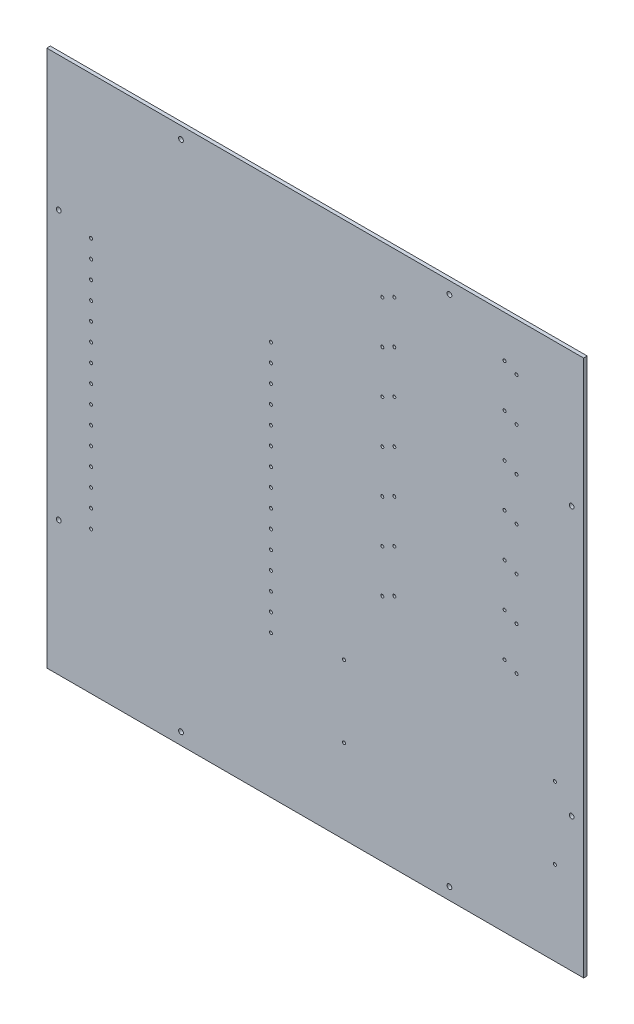
from build123d import *

# Parameters (mm, degrees)
SCHIZZO1_W                   = 448
SCHIZZO1_H                   = 448
SCHIZZO1_R                   = 2
SCHIZZO1_R_2                 = 1.25
ESTRUSIONE_ESTRUSIONE1_DEPTH = 3


with BuildPart() as part:
    # Schizzo1 → Estrusione-Estrusione1 (new body)
    with BuildSketch(Plane.XY):
        with Locations((224, 224)):
            Rectangle(SCHIZZO1_W, SCHIZZO1_H)
        with Locations((10, 336)):
            Circle(SCHIZZO1_R, mode=Mode.SUBTRACT)
        with Locations((336, 438)):
            Circle(SCHIZZO1_R, mode=Mode.SUBTRACT)
        with Locations((438, 336)):
            Circle(SCHIZZO1_R, mode=Mode.SUBTRACT)
        with Locations((438, 112)):
            Circle(SCHIZZO1_R, mode=Mode.SUBTRACT)
        with Locations((336, 10)):
            Circle(SCHIZZO1_R, mode=Mode.SUBTRACT)
        with Locations((112, 10)):
            Circle(SCHIZZO1_R, mode=Mode.SUBTRACT)
        with Locations((10, 112)):
            Circle(SCHIZZO1_R, mode=Mode.SUBTRACT)
        with Locations((36.958788995, 224)):
            Circle(SCHIZZO1_R_2, mode=Mode.SUBTRACT)
        with Locations((112, 438)):
            Circle(SCHIZZO1_R, mode=Mode.SUBTRACT)
        with Locations((36.958788995, 239)):
            Circle(SCHIZZO1_R_2, mode=Mode.SUBTRACT)
        with Locations((36.958788995, 254)):
            Circle(SCHIZZO1_R_2, mode=Mode.SUBTRACT)
        with Locations((36.958788995, 269)):
            Circle(SCHIZZO1_R_2, mode=Mode.SUBTRACT)
        with Locations((36.958788995, 284)):
            Circle(SCHIZZO1_R_2, mode=Mode.SUBTRACT)
        with Locations((36.958788995, 299)):
            Circle(SCHIZZO1_R_2, mode=Mode.SUBTRACT)
        with Locations((36.958788995, 314)):
            Circle(SCHIZZO1_R_2, mode=Mode.SUBTRACT)
        with Locations((36.958788995, 329)):
            Circle(SCHIZZO1_R_2, mode=Mode.SUBTRACT)
        with Locations((248, 70)):
            Circle(SCHIZZO1_R_2, mode=Mode.SUBTRACT)
        with Locations((248, 130)):
            Circle(SCHIZZO1_R_2, mode=Mode.SUBTRACT)
        with Locations((424, 130)):
            Circle(SCHIZZO1_R_2, mode=Mode.SUBTRACT)
        with Locations((424, 70)):
            Circle(SCHIZZO1_R_2, mode=Mode.SUBTRACT)
        with Locations((290, 413)):
            Circle(SCHIZZO1_R_2, mode=Mode.SUBTRACT)
        with Locations((280, 408)):
            Circle(SCHIZZO1_R_2, mode=Mode.SUBTRACT)
        with Locations((392, 408)):
            Circle(SCHIZZO1_R_2, mode=Mode.SUBTRACT)
        with Locations((382, 413)):
            Circle(SCHIZZO1_R_2, mode=Mode.SUBTRACT)
        with Locations((290, 377)):
            Circle(SCHIZZO1_R_2, mode=Mode.SUBTRACT)
        with Locations((280, 372)):
            Circle(SCHIZZO1_R_2, mode=Mode.SUBTRACT)
        with Locations((392, 372)):
            Circle(SCHIZZO1_R_2, mode=Mode.SUBTRACT)
        with Locations((382, 377)):
            Circle(SCHIZZO1_R_2, mode=Mode.SUBTRACT)
        with Locations((290, 341)):
            Circle(SCHIZZO1_R_2, mode=Mode.SUBTRACT)
        with Locations((280, 336)):
            Circle(SCHIZZO1_R_2, mode=Mode.SUBTRACT)
        with Locations((392, 336)):
            Circle(SCHIZZO1_R_2, mode=Mode.SUBTRACT)
        with Locations((382, 341)):
            Circle(SCHIZZO1_R_2, mode=Mode.SUBTRACT)
        with Locations((290, 305)):
            Circle(SCHIZZO1_R_2, mode=Mode.SUBTRACT)
        with Locations((280, 300)):
            Circle(SCHIZZO1_R_2, mode=Mode.SUBTRACT)
        with Locations((392, 300)):
            Circle(SCHIZZO1_R_2, mode=Mode.SUBTRACT)
        with Locations((382, 305)):
            Circle(SCHIZZO1_R_2, mode=Mode.SUBTRACT)
        with Locations((290, 269)):
            Circle(SCHIZZO1_R_2, mode=Mode.SUBTRACT)
        with Locations((280, 264)):
            Circle(SCHIZZO1_R_2, mode=Mode.SUBTRACT)
        with Locations((392, 264)):
            Circle(SCHIZZO1_R_2, mode=Mode.SUBTRACT)
        with Locations((382, 269)):
            Circle(SCHIZZO1_R_2, mode=Mode.SUBTRACT)
        with Locations((290, 233)):
            Circle(SCHIZZO1_R_2, mode=Mode.SUBTRACT)
        with Locations((280, 228)):
            Circle(SCHIZZO1_R_2, mode=Mode.SUBTRACT)
        with Locations((392, 228)):
            Circle(SCHIZZO1_R_2, mode=Mode.SUBTRACT)
        with Locations((382, 233)):
            Circle(SCHIZZO1_R_2, mode=Mode.SUBTRACT)
        with Locations((290, 197)):
            Circle(SCHIZZO1_R_2, mode=Mode.SUBTRACT)
        with Locations((280, 192)):
            Circle(SCHIZZO1_R_2, mode=Mode.SUBTRACT)
        with Locations((392, 192)):
            Circle(SCHIZZO1_R_2, mode=Mode.SUBTRACT)
        with Locations((382, 197)):
            Circle(SCHIZZO1_R_2, mode=Mode.SUBTRACT)
        with Locations((36.958788995, 119)):
            Circle(SCHIZZO1_R_2, mode=Mode.SUBTRACT)
        with Locations((36.958788995, 134)):
            Circle(SCHIZZO1_R_2, mode=Mode.SUBTRACT)
        with Locations((36.958788995, 149)):
            Circle(SCHIZZO1_R_2, mode=Mode.SUBTRACT)
        with Locations((36.958788995, 164)):
            Circle(SCHIZZO1_R_2, mode=Mode.SUBTRACT)
        with Locations((36.958788995, 179)):
            Circle(SCHIZZO1_R_2, mode=Mode.SUBTRACT)
        with Locations((36.958788995, 194)):
            Circle(SCHIZZO1_R_2, mode=Mode.SUBTRACT)
        with Locations((36.958788995, 209)):
            Circle(SCHIZZO1_R_2, mode=Mode.SUBTRACT)
        with Locations((187.041211005, 209)):
            Circle(SCHIZZO1_R_2, mode=Mode.SUBTRACT)
        with Locations((187.041211005, 194)):
            Circle(SCHIZZO1_R_2, mode=Mode.SUBTRACT)
        with Locations((187.041211005, 179)):
            Circle(SCHIZZO1_R_2, mode=Mode.SUBTRACT)
        with Locations((187.041211005, 164)):
            Circle(SCHIZZO1_R_2, mode=Mode.SUBTRACT)
        with Locations((187.041211005, 149)):
            Circle(SCHIZZO1_R_2, mode=Mode.SUBTRACT)
        with Locations((187.041211005, 134)):
            Circle(SCHIZZO1_R_2, mode=Mode.SUBTRACT)
        with Locations((187.041211005, 119)):
            Circle(SCHIZZO1_R_2, mode=Mode.SUBTRACT)
        with Locations((187.041211005, 329)):
            Circle(SCHIZZO1_R_2, mode=Mode.SUBTRACT)
        with Locations((187.041211005, 314)):
            Circle(SCHIZZO1_R_2, mode=Mode.SUBTRACT)
        with Locations((187.041211005, 299)):
            Circle(SCHIZZO1_R_2, mode=Mode.SUBTRACT)
        with Locations((187.041211005, 284)):
            Circle(SCHIZZO1_R_2, mode=Mode.SUBTRACT)
        with Locations((187.041211005, 269)):
            Circle(SCHIZZO1_R_2, mode=Mode.SUBTRACT)
        with Locations((187.041211005, 254)):
            Circle(SCHIZZO1_R_2, mode=Mode.SUBTRACT)
        with Locations((187.041211005, 239)):
            Circle(SCHIZZO1_R_2, mode=Mode.SUBTRACT)
        with Locations((187.041211005, 224)):
            Circle(SCHIZZO1_R_2, mode=Mode.SUBTRACT)
    extrude(amount=-ESTRUSIONE_ESTRUSIONE1_DEPTH)


solid = part.part
